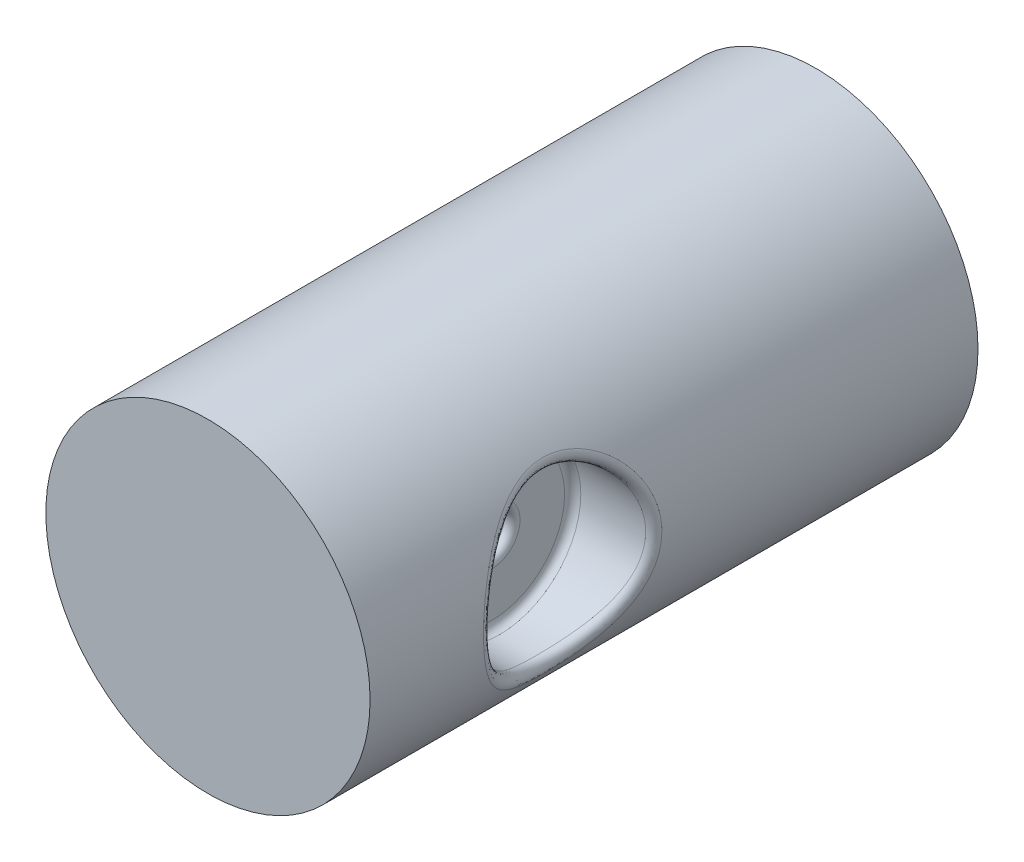
from build123d import *

# Parameters (mm, degrees)
SKETCH1_R           = 20
BOSS_EXTRUDE1_DEPTH = 75
SKETCH2_R           = 10
CUT_EXTRUDE1_DEPTH  = 10
SKETCH3_R           = 2.5
CUT_EXTRUDE2_DEPTH  = 20
FILLET1_R           = 1


with BuildPart() as part:
    # Sketch1 → Boss-Extrude1 (new body)
    with BuildSketch(Plane.XY):
        Circle(SKETCH1_R)
    extrude(amount=BOSS_EXTRUDE1_DEPTH)

    # Sketch2 → Cut-Extrude1 (cut)
    with BuildSketch(Plane(origin=(20, 0, 0), x_dir=(0, 0, -1), z_dir=(1, 0, 0))):
        with Locations((-50, 0)):
            Circle(SKETCH2_R)
    extrude(amount=-CUT_EXTRUDE1_DEPTH, mode=Mode.SUBTRACT)

    # Sketch3 → Cut-Extrude2 (cut)
    with BuildSketch(Plane(origin=(20, 0, 0), x_dir=(0, 0, -1), z_dir=(1, 0, 0))):
        with Locations((-50, 0)):
            Circle(SKETCH3_R)
    extrude(amount=-CUT_EXTRUDE2_DEPTH, mode=Mode.SUBTRACT)

    # Fillet1
    fillet1_edges = [part.edges().sort_by_distance(p)[0] for p in [
        (10, 0, 52.5),
        (0, 0, 52.5),
        (17.320510975, 9.999994979, 50.010021457),
        (10, 0, 60),
    ]]
    fillet(fillet1_edges, radius=FILLET1_R - 0.0001)  # a hair under: the kernel refuses the full size


solid = part.part
